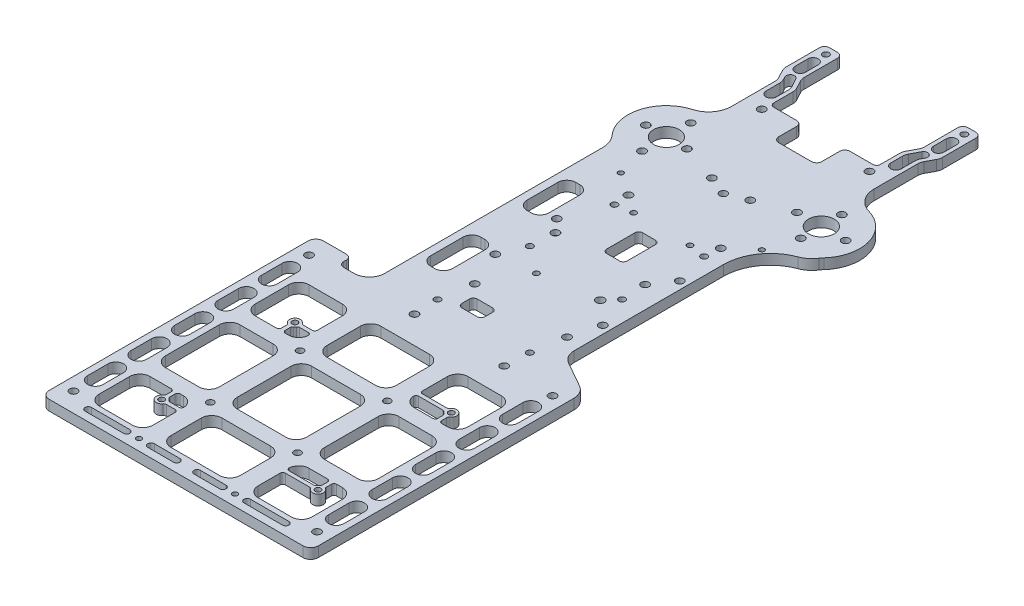
from build123d import *
from OCP.BRepFilletAPI import BRepFilletAPI_MakeChamfer

# Parameters (mm, degrees)
SKETCH_1_W                = 130
SKETCH_1_H                = 250
SKETCH_1_R                = 5
SKETCH_1_R_2              = 1.5
SKETCH_1_R_3              = 1.45
EXTRUDE_1_DEPTH           = 4
SKETCH_2_R                = 1.5
SKETCH_2_R_2              = 1.25
SKETCH_2_R_3              = 1.1
SKETCH_2_R_4              = 1.6
CUT_EXTRUDE_1_DEPTH       = 162.694155739
SKETCH_3_R                = 1.25
EXTRUDE_2_DEPTH           = 4
SKETCH_8_R                = 1
CUT_EXTRUDE_5_DEPTH       = 162.694155739
CUT_EXTRUDE_7_DEPTH       = 162.694155739
FILLET_1_R                = 2
FILLET_10_R               = 4
FILLET_2_R                = 6
FILLET_3_R                = 2
SKETCH_5_R                = 1.5
SKETCH_5_R_2              = 1.25
SKETCH_5_W                = 9
SKETCH_5_H                = 6
SKETCH_5_W_2              = 8
SKETCH_5_H_2              = 14
CUT_EXTRUDE_2_DEPTH       = 162.694155739
FILLET_4_R                = 1.5
CUT_EXTRUDE_START         = -4
CUT_EXTRUDE_3_OUTLINE_W   = 27
CUT_EXTRUDE_3_OUTLINE_H   = 29
CUT_EXTRUDE_3_OUTLINE_H_2 = 21
CUT_EXTRUDE_3_OUTLINE_H_3 = 19.88
CUT_EXTRUDE_3_OUTLINE_W_2 = 21
CUT_EXTRUDE_3_OUTLINE_R   = 1.35
CUT_EXTRUDE_3_DEPTH       = 4
FILLET_5_R                = 4
SKETCH_7_R                = 1
CUT_EXTRUDE_4_DEPTH       = 162.694155739
FILLET_6_R                = 3
FILLET_7_R                = 6
FILLET_8_R                = 2
SKETCH_9_W                = 8.582794104
SKETCH_9_H                = 19.62
SKETCH_9_H_2              = 19
CUT_EXTRUDE_6_DEPTH       = 162.694155739
FILLET_9_R                = 3.5
EXTRUDE_3_DEPTH           = 4
FILLET_11_R               = 1
CHAMFER_1_SIZE            = 2
CHAMFER_1_SIZE2           = 1.5


# Read off the part's stored shape, not the designer's step: 切除-拉伸3
with BuildPart() as part:
    # 草图1 → 凸台-拉伸1 (new body)
    with BuildSketch(Plane(origin=(0, 0, 0), x_dir=(1, 0, 0), z_dir=(0, 1, 0))):
        with Locations((0, -23)):
            Rectangle(SKETCH_1_W, SKETCH_1_H)
        with Locations(Location((-30.225, 61, 0), (0, 0, 270))):
            Circle(SKETCH_1_R, mode=Mode.SUBTRACT)
        with Locations(Location((-38.225, 61, 0), (0, 0, 270))):
            Circle(SKETCH_1_R_2, mode=Mode.SUBTRACT)
        with Locations(Location((-22.225, 61, 0), (0, 0, 270))):
            Circle(SKETCH_1_R_2, mode=Mode.SUBTRACT)
        with Locations(Location((-30.225, 70.5, 0), (0, 0, 270))):
            Circle(SKETCH_1_R_2, mode=Mode.SUBTRACT)
        with Locations(Location((-30.225, 51.5, 0), (0, 0, 270))):
            Circle(SKETCH_1_R_2, mode=Mode.SUBTRACT)
        with Locations(Location((30.225, 61, 0), (0, 0, 270))):
            Circle(SKETCH_1_R, mode=Mode.SUBTRACT)
        with Locations(Location((30.225, 53, 0), (0, 0, 270))):
            Circle(SKETCH_1_R_2, mode=Mode.SUBTRACT)
        with Locations(Location((30.225, 69, 0), (0, 0, 270))):
            Circle(SKETCH_1_R_2, mode=Mode.SUBTRACT)
        with Locations(Location((20.725, 61, 0), (0, 0, 270))):
            Circle(SKETCH_1_R_2, mode=Mode.SUBTRACT)
        with Locations(Location((39.725, 61, 0), (0, 0, 270))):
            Circle(SKETCH_1_R_2, mode=Mode.SUBTRACT)
        with Locations(Location((-21, 89, 0), (0, 0, 270))):
            Circle(SKETCH_1_R_2, mode=Mode.SUBTRACT)
        with Locations(Location((21, 89, 0), (0, 0, 90))):
            Circle(SKETCH_1_R_2, mode=Mode.SUBTRACT)
        with Locations(Location((-60, -48.62, 0), (0, 0, 270))):
            Circle(SKETCH_1_R_2, mode=Mode.SUBTRACT)
        with Locations(Location((-60, -140.5, 0), (0, 0, 270))):
            Circle(SKETCH_1_R_2, mode=Mode.SUBTRACT)
        with Locations(Location((35, -140.5, 0), (0, 0, 90))):
            Circle(SKETCH_1_R_2, mode=Mode.SUBTRACT)
        with Locations(Location((35, -48.62, 0), (0, 0, 90))):
            Circle(SKETCH_1_R_2, mode=Mode.SUBTRACT)
        with Locations(Location((-7.5, 56, 0), (0, 0, 270))):
            Circle(SKETCH_1_R_2, mode=Mode.SUBTRACT)
        with Locations(Location((7.5, 56, 0), (0, 0, 90))):
            Circle(SKETCH_1_R_2, mode=Mode.SUBTRACT)
        with Locations(Location((0, 53, 0), (0, 0, 270))):
            Circle(SKETCH_1_R_3, mode=Mode.SUBTRACT)
    extrude(amount=EXTRUDE_1_DEPTH)

    # 草图2 → 切除-拉伸1 (cut, through all)
    with BuildSketch(Plane(origin=(0, 4, 0), x_dir=(1, 0, 0), z_dir=(0, 1, 0))):
        Polygon((20.8, 102), (-20.8, 102), (-20.8, 92), (-8.4, 92), (-8.4, 81), (8.4, 81), (8.4, 92), (20.8, 92), align=None)
        with BuildLine():
            Line((-27.85, 84), (-27.85, 102))
            Line((-27.85, 102), (-65, 102))
            Line((-65, 102), (-65, -41))
            Line((-65, -41), (-51.082794104, -41))
            Line((-51.082794104, -41), (-51.082794104, -46))
            Line((-51.082794104, -46), (-39.082794104, -46))
            Line((-39.082794104, -46), (-39.082794104, 45))
            ThreePointArc((-39.082794104, 45), (-39.674693481, 48.193418147), (-41.371755389, 50.962577806))
            ThreePointArc((-41.371755389, 50.962577806), (-44.639046128, 65.151538779), (-34.324986836, 75.428794404))
            ThreePointArc((-34.324986836, 75.428794404), (-29.650694588, 78.62898939), (-27.85, 84))
        make_face()
        with BuildLine():
            ThreePointArc((41.371755389, 50.962577806), (40.920524993, 50.419688798), (40.513686931, 49.842783141))
            ThreePointArc((40.513686931, 49.842783141), (38.507267418, 47.62069527), (35.904154342, 46.141778068))
            ThreePointArc((35.904154342, 46.141778068), (27.267917933, 39.434910708), (24, 29))
            Line((24, 29), (24, -32.681874819))
            Line((24, -32.681874819), (40, -41.78))
            Line((40, -41.78), (40, -148))
            Line((40, -148), (65, -148))
            Line((65, -148), (65, 102))
            Line((65, 102), (27.85, 102))
            Line((27.85, 102), (27.85, 84))
            ThreePointArc((27.85, 84), (29.650694588, 78.62898939), (34.324986836, 75.428794404))
            ThreePointArc((34.324986836, 75.428794404), (44.639046128, 65.151538779), (41.371755389, 50.962577806))
        make_face()
        with Locations(Location((21, 15, 0), (0, 0, 270))):
            Circle(SKETCH_2_R)
        with Locations(Location((21, -15, 0), (0, 0, 90))):
            Circle(SKETCH_2_R)
        with Locations(Location((-18, 34, 0), (0, 0, 270))):
            Circle(SKETCH_2_R)
        with Locations(Location((18, 34, 0), (0, 0, 270))):
            Circle(SKETCH_2_R)
        with Locations(Location((-18, -26, 0), (0, 0, 270))):
            Circle(SKETCH_2_R)
        with Locations(Location((18, -26, 0), (0, 0, 270))):
            Circle(SKETCH_2_R)
        with Locations(Location((-24, -12, 0), (0, 0, 270))):
            Circle(SKETCH_2_R)
        with Locations(Location((-24, 12, 0), (0, 0, 270))):
            Circle(SKETCH_2_R)
        with Locations(Location((-17.5, 28, 0), (0, 0, 270))):
            Circle(SKETCH_2_R_2)
        with Locations(Location((17.5, 28, 0), (0, 0, 270))):
            Circle(SKETCH_2_R_2)
        with Locations(Location((-9.527699014, -10.417590797, 0), (0, 0, 270))):
            Circle(SKETCH_2_R_3)
        with Locations(Location((11, 29.000000002, 0), (0, 0, 270))):
            Circle(SKETCH_2_R_3)
        with Locations(Location((-11, 29.000000002, 0), (0, 0, 270))):
            Circle(SKETCH_2_R_3)
        with Locations(Location((12, -7, 0), (0, 0, 270))):
            Circle(SKETCH_2_R_4)
    extrude(amount=-CUT_EXTRUDE_1_DEPTH, mode=Mode.SUBTRACT)

    # 草图3 → 凸台-拉伸2 (add)
    # profile 1 of 2: a face of its own
    with BuildSketch(Plane(origin=(0, 4, 0), x_dir=(1, 0, 0), z_dir=(0, 1, 0))):
        Polygon((-30.525, 123), (-23.475, 123), (-23.475, 107), (-20.8, 102), (-27.85, 102), (-30.525, 107), align=None)
        with Locations(Location((-27, 120, 0), (0, 0, 270))):
            Circle(SKETCH_3_R, mode=Mode.SUBTRACT)
        with BuildLine():
            Line((-24.975, 115), (-24.975, 110))
            ThreePointArc((-24.975, 110), (-27, 107.975), (-29.025, 110))
            Line((-29.025, 110), (-29.025, 115))
            ThreePointArc((-29.025, 115), (-27, 117.025), (-24.975, 115))
        make_face(mode=Mode.SUBTRACT)
    # profile 2 of 2: a face of its own
    with BuildSketch(Plane(origin=(0, 4, 0), x_dir=(1, 0, 0), z_dir=(0, 1, 0))):
        Polygon((20.8, 102), (23.475, 107), (23.475, 123), (30.525, 123), (30.525, 107), (27.85, 102), align=None)
        with Locations(Location((27, 120, 0), (0, 0, 270))):
            Circle(SKETCH_3_R, mode=Mode.SUBTRACT)
        with BuildLine():
            Line((24.975, 115), (24.975, 110))
            ThreePointArc((24.975, 110), (27, 107.975), (29.025, 110))
            Line((29.025, 110), (29.025, 115))
            ThreePointArc((29.025, 115), (27, 117.025), (24.975, 115))
        make_face(mode=Mode.SUBTRACT)
    extrude(amount=-EXTRUDE_2_DEPTH)

    # 草图8 → 切除-拉伸5 (cut, through all)
    with BuildSketch(Plane(origin=(0, 4, 0), x_dir=(1, 0, 0), z_dir=(0, 1, 0))):
        with Locations(Location((-27, 40, 0), (0, 0, 270))):
            Circle(SKETCH_8_R)
        with Locations(Location((26.5, 41.5, 0), (0, 0, 270))):
            Circle(SKETCH_8_R)
    extrude(amount=-CUT_EXTRUDE_5_DEPTH, mode=Mode.SUBTRACT)

    # 草图10 → 切除-拉伸7 (cut, through all)
    with BuildSketch(Plane(origin=(0, 4, 0), x_dir=(1, 0, 0), z_dir=(0, 1, 0))):
        with BuildLine():
            Line((-27.403592373, 104.345364997), (-26.35, 102.376033459))
            Line((-26.35, 102.376033459), (-26.35, 96))
            ThreePointArc((-26.35, 96), (-24.325, 93.975), (-22.3, 96))
            Line((-22.3, 96), (-22.3, 101.623966541))
            Line((-22.3, 101.623966541), (-24.567662269, 105.862587603))
            ThreePointArc((-24.567662269, 105.862587603), (-26.744238624, 106.521941353), (-27.403592373, 104.345364997))
        make_face()
        with BuildLine():
            Line((22.3, 101.623966541), (24.567662269, 105.862587603))
            ThreePointArc((24.567662269, 105.862587603), (26.744238624, 106.521941353), (27.403592373, 104.345364997))
            Line((27.403592373, 104.345364997), (26.35, 102.376033459))
            Line((26.35, 102.376033459), (26.35, 96))
            ThreePointArc((26.35, 96), (24.325, 93.975), (22.3, 96))
            Line((22.3, 96), (22.3, 101.623966541))
        make_face()
    extrude(amount=-CUT_EXTRUDE_7_DEPTH, mode=Mode.SUBTRACT)

    # 圆角1
    fillet_1_edges = [part.edges().sort_by_distance(p)[0] for p in [
        (23.475, 2, -123),
        (30.525, 2, -123),
        (-23.475, 2, -123),
        (-30.525, 2, -123),
    ]]
    fillet(fillet_1_edges, radius=FILLET_1_R)

    # 圆角10
    fillet_10_edges = [part.edges().sort_by_distance(p)[0] for p in [
        (27.85, 2, -102),
        (-27.85, 2, -102),
        (-20.8, 2, -102),
        (20.8, 2, -102),
        (23.475, 2, -107),
        (30.525, 2, -107),
        (-23.475, 2, -107),
        (-30.525, 2, -107),
        (-22.3, 2, -101.623966541),
        (-26.35, 2, -102.376033459),
        (22.3, 2, -101.623966541),
        (26.35, 2, -102.376033459),
    ]]
    fillet(fillet_10_edges, radius=FILLET_10_R)

    # 圆角2
    fillet_2_edges = [part.edges().sort_by_distance(p)[0] for p in [
        (-39.082794104, 2, 46),
    ]]
    fillet(fillet_2_edges, radius=FILLET_2_R)

    # 圆角3
    fillet_3_edges = [part.edges().sort_by_distance(p)[0] for p in [
        (-51.082794104, 2, 46),
        (-51.082794104, 2, 41),
    ]]
    fillet(fillet_3_edges, radius=FILLET_3_R)

    # 草图5 → 切除-拉伸2 (cut, through all)
    with BuildSketch(Plane(origin=(0, 4, 0), x_dir=(1, 0, 0), z_dir=(0, 1, 0))):
        with Locations(Location((-19.5, 7, 0), (0, 0, 270))):
            Circle(SKETCH_5_R)
        with Locations(Location((-19.5, -48, 0), (0, 0, 270))):
            Circle(SKETCH_5_R)
        with Locations(Location((-20, -2.5, 0), (0, 0, 270))):
            Circle(SKETCH_5_R_2)
        with Locations(Location((16, -2.5, 0), (0, 0, 270))):
            Circle(SKETCH_5_R_2)
        with Locations(Location((16, -38.5, 0), (0, 0, 270))):
            Circle(SKETCH_5_R_2)
        with Locations(Location((-20, -38.5, 0), (0, 0, 270))):
            Circle(SKETCH_5_R_2)
        with Locations(Location((15.5, -48, 0), (0, 0, 90))):
            Circle(SKETCH_5_R)
        with Locations(Location((15.5, 7, 0), (0, 0, 90))):
            Circle(SKETCH_5_R)
        with Locations((-9.4, -33.62)):
            Rectangle(SKETCH_5_W, SKETCH_5_H)
        with Locations((0, 17)):
            Rectangle(SKETCH_5_W_2, SKETCH_5_H_2)
    extrude(amount=-CUT_EXTRUDE_2_DEPTH, mode=Mode.SUBTRACT)

    # 圆角4
    fillet_4_edges = [part.edges().sort_by_distance(p)[0] for p in [
        (20.8, 2, -92),
        (-20.8, 2, -92),
        (-4.9, 2, 30.62),
        (-4.9, 2, 36.62),
        (-13.9, 2, 36.62),
        (-13.9, 2, 30.62),
        (4, 2, -24),
        (4, 2, -10),
        (-4, 2, -10),
        (-4, 2, -24),
    ]]
    fillet(fillet_4_edges, radius=FILLET_4_R)

    # 切除-拉伸3 outline → 切除-拉伸3 (cut)
    with BuildSketch(Plane(origin=(0, 4, 0), x_dir=(1, 0, 0), z_dir=(0, 1, 0)).offset(CUT_EXTRUDE_START)):
        with Locations((-12.5, -100.12)):
            Rectangle(CUT_EXTRUDE_3_OUTLINE_W, CUT_EXTRUDE_3_OUTLINE_H)
        with Locations((-12.5, -69.12)):
            Rectangle(CUT_EXTRUDE_3_OUTLINE_W, CUT_EXTRUDE_3_OUTLINE_H_2)
        with Locations((-12.5, -130.56)):
            Rectangle(CUT_EXTRUDE_3_OUTLINE_W, CUT_EXTRUDE_3_OUTLINE_H_3)
        with Locations((-43.5, -100.12)):
            Rectangle(CUT_EXTRUDE_3_OUTLINE_W_2, CUT_EXTRUDE_3_OUTLINE_H)
        with Locations((18.5, -100.12)):
            Rectangle(CUT_EXTRUDE_3_OUTLINE_W_2, CUT_EXTRUDE_3_OUTLINE_H)
        with Locations((18.5, -130.56)):
            Rectangle(CUT_EXTRUDE_3_OUTLINE_W_2, CUT_EXTRUDE_3_OUTLINE_H_3)
        with Locations((18.5, -69.12)):
            Rectangle(CUT_EXTRUDE_3_OUTLINE_W_2, CUT_EXTRUDE_3_OUTLINE_H_2)
        with Locations((-43.5, -130.56)):
            Rectangle(CUT_EXTRUDE_3_OUTLINE_W_2, CUT_EXTRUDE_3_OUTLINE_H_3)
        with Locations((-43.5, -69.12)):
            Rectangle(CUT_EXTRUDE_3_OUTLINE_W_2, CUT_EXTRUDE_3_OUTLINE_H_2)
        with Locations((-29.5, -117.62)):
            Circle(CUT_EXTRUDE_3_OUTLINE_R)
        with Locations((4.5, -82.62)):
            Circle(CUT_EXTRUDE_3_OUTLINE_R)
        with Locations((-29.5, -82.62)):
            Circle(CUT_EXTRUDE_3_OUTLINE_R)
        with Locations((4.5, -117.62)):
            Circle(CUT_EXTRUDE_3_OUTLINE_R)
    extrude(amount=CUT_EXTRUDE_3_DEPTH, mode=Mode.SUBTRACT)

    # 圆角5
    fillet_5_edges = [part.edges().sort_by_distance(p)[0] for p in [
        (8, 2, 114.62),
        (8, 2, 85.62),
        (29, 2, 85.62),
        (29, 2, 114.62),
        (8, 2, 79.62),
        (8, 2, 58.62),
        (29, 2, 58.62),
        (29, 2, 79.62),
        (-26, 2, 140.5),
        (-26, 2, 120.62),
        (1, 2, 120.62),
        (1, 2, 140.5),
        (-26, 2, 79.62),
        (-26, 2, 58.62),
        (1, 2, 58.62),
        (1, 2, 79.62),
        (-54, 2, 114.62),
        (-54, 2, 85.62),
        (-33, 2, 85.62),
        (-33, 2, 114.62),
        (-54, 2, 79.62),
        (-54, 2, 58.62),
        (-33, 2, 58.62),
        (-33, 2, 79.62),
        (-54, 2, 120.62),
        (-33, 2, 120.62),
        (-33, 2, 140.5),
        (-54, 2, 140.5),
        (8, 2, 140.5),
        (8, 2, 120.62),
        (29, 2, 120.62),
        (29, 2, 140.5),
        (-26, 2, 114.62),
        (-26, 2, 85.62),
        (1, 2, 85.62),
        (1, 2, 114.62),
    ]]
    fillet(fillet_5_edges, radius=FILLET_5_R)

    # 草图7 → 切除-拉伸4 (cut, through all)
    with BuildSketch(Plane(origin=(0, 4, 0), x_dir=(1, 0, 0), z_dir=(0, 1, 0))):
        with Locations(Location((-31.25, -143.75, 0), (0, 0, 270))):
            Circle(SKETCH_7_R)
        with Locations(Location((6.25, -143.75, 0), (0, 0, 90))):
            Circle(SKETCH_7_R)
        with BuildLine():
            Line((-56.5, -56.62), (-56.5, -64.62))
            ThreePointArc((-56.5, -64.62), (-59.5, -67.62), (-62.5, -64.62))
            Line((-62.5, -64.62), (-62.5, -56.62))
            ThreePointArc((-62.5, -56.62), (-59.5, -53.62), (-56.5, -56.62))
        make_face()
        with BuildLine():
            Line((31.5, -56.62), (31.5, -64.62))
            ThreePointArc((31.5, -64.62), (34.5, -67.62), (37.5, -64.62))
            Line((37.5, -64.62), (37.5, -56.62))
            ThreePointArc((37.5, -56.62), (34.5, -53.62), (31.5, -56.62))
        make_face()
        with BuildLine():
            Line((-56.5, -73.59), (-56.5, -81.59))
            ThreePointArc((-56.5, -81.59), (-59.5, -84.59), (-62.5, -81.59))
            Line((-62.5, -81.59), (-62.5, -73.59))
            ThreePointArc((-62.5, -73.59), (-59.5, -70.59), (-56.5, -73.59))
        make_face()
        with BuildLine():
            Line((31.5, -73.59), (31.5, -81.59))
            ThreePointArc((31.5, -81.59), (34.5, -84.59), (37.5, -81.59))
            Line((37.5, -81.59), (37.5, -73.59))
            ThreePointArc((37.5, -73.59), (34.5, -70.59), (31.5, -73.59))
        make_face()
        with BuildLine():
            Line((-56.5, -90.56), (-56.5, -98.56))
            ThreePointArc((-56.5, -98.56), (-59.5, -101.56), (-62.5, -98.56))
            Line((-62.5, -98.56), (-62.5, -90.56))
            ThreePointArc((-62.5, -90.56), (-59.5, -87.56), (-56.5, -90.56))
        make_face()
        with BuildLine():
            Line((31.5, -90.56), (31.5, -98.56))
            ThreePointArc((31.5, -98.56), (34.5, -101.56), (37.5, -98.56))
            Line((37.5, -98.56), (37.5, -90.56))
            ThreePointArc((37.5, -90.56), (34.5, -87.56), (31.5, -90.56))
        make_face()
        with BuildLine():
            Line((-56.5, -107.53), (-56.5, -115.53))
            ThreePointArc((-56.5, -115.53), (-59.5, -118.53), (-62.5, -115.53))
            Line((-62.5, -115.53), (-62.5, -107.53))
            ThreePointArc((-62.5, -107.53), (-59.5, -104.53), (-56.5, -107.53))
        make_face()
        with BuildLine():
            Line((31.5, -107.53), (31.5, -115.53))
            ThreePointArc((31.5, -115.53), (34.5, -118.53), (37.5, -115.53))
            Line((37.5, -115.53), (37.5, -107.53))
            ThreePointArc((37.5, -107.53), (34.5, -104.53), (31.5, -107.53))
        make_face()
        with BuildLine():
            Line((-56.5, -124.5), (-56.5, -132.5))
            ThreePointArc((-56.5, -132.5), (-59.5, -135.5), (-62.5, -132.5))
            Line((-62.5, -132.5), (-62.5, -124.5))
            ThreePointArc((-62.5, -124.5), (-59.5, -121.5), (-56.5, -124.5))
        make_face()
        with BuildLine():
            Line((31.5, -124.5), (31.5, -132.5))
            ThreePointArc((31.5, -132.5), (34.5, -135.5), (37.5, -132.5))
            Line((37.5, -132.5), (37.5, -124.5))
            ThreePointArc((37.5, -124.5), (34.5, -121.5), (31.5, -124.5))
        make_face()
        with BuildLine():
            Line((-8.5, -142.5), (1.5, -142.5))
            ThreePointArc((1.5, -142.5), (2.75, -143.75), (1.5, -145))
            Line((1.5, -145), (-8.5, -145))
            ThreePointArc((-8.5, -145), (-9.75, -143.75), (-8.5, -142.5))
        make_face()
        with BuildLine():
            Line((11, -142.5), (26, -142.5))
            ThreePointArc((26, -142.5), (27.25, -143.75), (26, -145))
            Line((26, -145), (11, -145))
            ThreePointArc((11, -145), (9.75, -143.75), (11, -142.5))
        make_face()
        with BuildLine():
            Line((-16.5, -142.5), (-26.5, -142.5))
            ThreePointArc((-26.5, -142.5), (-27.75, -143.75), (-26.5, -145))
            Line((-26.5, -145), (-16.5, -145))
            ThreePointArc((-16.5, -145), (-15.25, -143.75), (-16.5, -142.5))
        make_face()
        with BuildLine():
            Line((-36, -142.5), (-51, -142.5))
            ThreePointArc((-51, -142.5), (-52.25, -143.75), (-51, -145))
            Line((-51, -145), (-36, -145))
            ThreePointArc((-36, -145), (-34.75, -143.75), (-36, -142.5))
        make_face()
    extrude(amount=-CUT_EXTRUDE_4_DEPTH, mode=Mode.SUBTRACT)

    # 圆角6
    fillet_6_edges = [part.edges().sort_by_distance(p)[0] for p in [
        (40, 2, 148),
        (-65, 2, 41),
        (-65, 2, 148),
    ]]
    fillet(fillet_6_edges, radius=FILLET_6_R)

    # 圆角7
    fillet_7_edges = [part.edges().sort_by_distance(p)[0] for p in [
        (40, 2, 41.78),
        (24, 2, 32.681874819),
    ]]
    fillet(fillet_7_edges, radius=FILLET_7_R)

    # 圆角8
    fillet_8_edges = [part.edges().sort_by_distance(p)[0] for p in [
        (-8.4, 2, -92),
        (-8.4, 2, -81),
        (8.4, 2, -81),
        (8.4, 2, -92),
    ]]
    fillet(fillet_8_edges, radius=FILLET_8_R)

    # 草图9 → 切除-拉伸6 (cut, through all)
    with BuildSketch(Plane(origin=(0, 4, 0), x_dir=(1, 0, 0), z_dir=(0, 1, 0))):
        with Locations((-31.791397052, -18.81)):
            Rectangle(SKETCH_9_W, SKETCH_9_H)
        with Locations((-31.791397052, 18.5)):
            Rectangle(SKETCH_9_W, SKETCH_9_H_2)
    extrude(amount=-CUT_EXTRUDE_6_DEPTH, mode=Mode.SUBTRACT)

    # 圆角9
    fillet_9_edges = [part.edges().sort_by_distance(p)[0] for p in [
        (-27.5, 2, 9),
        (-27.5, 2, 28.62),
        (-36.082794104, 2, 28.62),
        (-36.082794104, 2, 9),
        (-27.5, 2, -28),
        (-27.5, 2, -9),
        (-36.082794104, 2, -9),
        (-36.082794104, 2, -28),
    ]]
    fillet(fillet_9_edges, radius=FILLET_9_R)

    # 草图11 → 凸台-拉伸3 (add)
    with BuildSketch(Plane(origin=(0, 4, 0), x_dir=(1, 0, 0), z_dir=(0, 1, 0))):
        with BuildLine():
            Line((-33, -73.37), (-38.038495475, -73.37))
            ThreePointArc((-38.038495475, -73.37), (-37.934914106, -73.73865993), (-37.9, -74.12))
            ThreePointArc((-37.9, -74.12), (-37.934914106, -74.50134007), (-38.038495475, -74.87))
            Line((-38.038495475, -74.87), (-33, -74.87))
            Line((-33, -74.87), (-33, -73.37))
        make_face()
        with BuildLine():
            Line((-40.75, -76.081504525), (-40.75, -74.924673847))
            ThreePointArc((-40.75, -74.924673847), (-40.777817459, -73.342182541), (-39.195326153, -73.37))
            Line((-39.195326153, -73.37), (-38.038495475, -73.37))
            ThreePointArc((-38.038495475, -73.37), (-41.48492424, -72.63507576), (-40.75, -76.081504525))
        make_face()
        with BuildLine():
            ThreePointArc((-39.25, -74.924673847), (-40, -75.22), (-40.75, -74.924673847))
            Line((-40.75, -74.924673847), (-40.75, -76.081504525))
            ThreePointArc((-40.75, -76.081504525), (-40, -76.22), (-39.25, -76.081504525))
            Line((-39.25, -76.081504525), (-39.25, -74.924673847))
        make_face()
        with BuildLine():
            ThreePointArc((-39.195326153, -74.87), (-39.222182541, -74.897817459), (-39.25, -74.924673847))
            Line((-39.25, -74.924673847), (-39.25, -76.081504525))
            ThreePointArc((-39.25, -76.081504525), (-38.51507576, -75.60492424), (-38.038495475, -74.87))
            Line((-38.038495475, -74.87), (-39.195326153, -74.87))
        make_face()
        with BuildLine():
            Line((-38.038495475, -73.37), (-39.195326153, -73.37))
            ThreePointArc((-39.195326153, -73.37), (-38.976491028, -73.71697471), (-38.9, -74.12))
            ThreePointArc((-38.9, -74.12), (-38.976491028, -74.52302529), (-39.195326153, -74.87))
            Line((-39.195326153, -74.87), (-38.038495475, -74.87))
            ThreePointArc((-38.038495475, -74.87), (-37.934914106, -74.50134007), (-37.9, -74.12))
            ThreePointArc((-37.9, -74.12), (-37.934914106, -73.73865993), (-38.038495475, -73.37))
        make_face()
        with BuildLine():
            ThreePointArc((-39.25, -76.081504525), (-40, -76.22), (-40.75, -76.081504525))
            Line((-40.75, -76.081504525), (-40.75, -79.62))
            Line((-40.75, -79.62), (-39.25, -79.62))
            Line((-39.25, -79.62), (-39.25, -76.081504525))
        make_face()
        with BuildLine():
            Line((19.038495475, -73.37), (8, -73.37))
            Line((8, -73.37), (8, -74.87))
            Line((8, -74.87), (19.038495475, -74.87))
            ThreePointArc((19.038495475, -74.87), (18.9, -74.12), (19.038495475, -73.37))
        make_face()
        with BuildLine():
            Line((20.195326153, -73.37), (19.038495475, -73.37))
            ThreePointArc((19.038495475, -73.37), (18.9, -74.12), (19.038495475, -74.87))
            Line((19.038495475, -74.87), (20.195326153, -74.87))
            ThreePointArc((20.195326153, -74.87), (19.9, -74.12), (20.195326153, -73.37))
        make_face()
        with BuildLine():
            Line((20.195326153, -74.87), (19.038495475, -74.87))
            ThreePointArc((19.038495475, -74.87), (19.51507576, -75.60492424), (20.25, -76.081504525))
            Line((20.25, -76.081504525), (20.25, -74.924673847))
            ThreePointArc((20.25, -74.924673847), (20.222182541, -74.897817459), (20.195326153, -74.87))
        make_face()
        with BuildLine():
            ThreePointArc((20.25, -76.081504525), (21, -76.22), (21.75, -76.081504525))
            Line((21.75, -76.081504525), (21.75, -74.924673847))
            ThreePointArc((21.75, -74.924673847), (21, -75.22), (20.25, -74.924673847))
            Line((20.25, -74.924673847), (20.25, -76.081504525))
        make_face()
        with BuildLine():
            ThreePointArc((23.1, -74.12), (21.38134007, -72.054914106), (19.038495475, -73.37))
            Line((19.038495475, -73.37), (20.195326153, -73.37))
            ThreePointArc((20.195326153, -73.37), (21.40302529, -73.096491028), (22.1, -74.12))
            ThreePointArc((22.1, -74.12), (22.00871205, -74.558748219), (21.75, -74.924673847))
            Line((21.75, -74.924673847), (21.75, -76.081504525))
            ThreePointArc((21.75, -76.081504525), (22.729884389, -75.31058809), (23.1, -74.12))
        make_face()
        with BuildLine():
            Line((21.75, -79.62), (21.75, -76.081504525))
            ThreePointArc((21.75, -76.081504525), (21, -76.22), (20.25, -76.081504525))
            Line((20.25, -76.081504525), (20.25, -79.62))
            Line((20.25, -79.62), (21.75, -79.62))
        make_face()
        with BuildLine():
            Line((20.195326153, -126.87), (19.038495475, -126.87))
            ThreePointArc((19.038495475, -126.87), (21.38134007, -128.185085894), (23.1, -126.12))
            ThreePointArc((23.1, -126.12), (22.729884389, -124.92941191), (21.75, -124.158495475))
            Line((21.75, -124.158495475), (21.75, -125.315326153))
            ThreePointArc((21.75, -125.315326153), (22.00871205, -125.681251781), (22.1, -126.12))
            ThreePointArc((22.1, -126.12), (21.40302529, -127.143508972), (20.195326153, -126.87))
        make_face()
        with BuildLine():
            Line((21.75, -125.315326153), (21.75, -124.158495475))
            ThreePointArc((21.75, -124.158495475), (21, -124.02), (20.25, -124.158495475))
            Line((20.25, -124.158495475), (20.25, -125.315326153))
            ThreePointArc((20.25, -125.315326153), (21, -125.02), (21.75, -125.315326153))
        make_face()
        with BuildLine():
            ThreePointArc((20.25, -124.158495475), (19.51507576, -124.63507576), (19.038495475, -125.37))
            Line((19.038495475, -125.37), (20.195326153, -125.37))
            ThreePointArc((20.195326153, -125.37), (20.222182541, -125.342182541), (20.25, -125.315326153))
            Line((20.25, -125.315326153), (20.25, -124.158495475))
        make_face()
        with BuildLine():
            ThreePointArc((19.038495475, -125.37), (18.9, -126.12), (19.038495475, -126.87))
            Line((19.038495475, -126.87), (20.195326153, -126.87))
            ThreePointArc((20.195326153, -126.87), (19.9, -126.12), (20.195326153, -125.37))
            Line((20.195326153, -125.37), (19.038495475, -125.37))
        make_face()
        with BuildLine():
            Line((8, -125.37), (8, -126.87))
            Line((8, -126.87), (19.038495475, -126.87))
            ThreePointArc((19.038495475, -126.87), (18.9, -126.12), (19.038495475, -125.37))
            Line((19.038495475, -125.37), (8, -125.37))
        make_face()
        with BuildLine():
            Line((21.75, -124.158495475), (21.75, -120.62))
            Line((21.75, -120.62), (20.25, -120.62))
            Line((20.25, -120.62), (20.25, -124.158495475))
            ThreePointArc((20.25, -124.158495475), (21, -124.02), (21.75, -124.158495475))
        make_face()
        with BuildLine():
            Line((-40.75, -125.315326153), (-40.75, -124.158495475))
            ThreePointArc((-40.75, -124.158495475), (-41.48492424, -127.60492424), (-38.038495475, -126.87))
            Line((-38.038495475, -126.87), (-39.195326153, -126.87))
            ThreePointArc((-39.195326153, -126.87), (-40.777817459, -126.897817459), (-40.75, -125.315326153))
        make_face()
        with BuildLine():
            Line((-39.195326153, -126.87), (-38.038495475, -126.87))
            ThreePointArc((-38.038495475, -126.87), (-37.934914106, -126.50134007), (-37.9, -126.12))
            ThreePointArc((-37.9, -126.12), (-37.934914106, -125.73865993), (-38.038495475, -125.37))
            Line((-38.038495475, -125.37), (-39.195326153, -125.37))
            ThreePointArc((-39.195326153, -125.37), (-38.976491028, -125.71697471), (-38.9, -126.12))
            ThreePointArc((-38.9, -126.12), (-38.976491028, -126.52302529), (-39.195326153, -126.87))
        make_face()
        with BuildLine():
            ThreePointArc((-38.038495475, -125.37), (-38.51507576, -124.63507576), (-39.25, -124.158495475))
            Line((-39.25, -124.158495475), (-39.25, -125.315326153))
            ThreePointArc((-39.25, -125.315326153), (-39.222182541, -125.342182541), (-39.195326153, -125.37))
            Line((-39.195326153, -125.37), (-38.038495475, -125.37))
        make_face()
        with BuildLine():
            ThreePointArc((-39.25, -124.158495475), (-40, -124.02), (-40.75, -124.158495475))
            Line((-40.75, -124.158495475), (-40.75, -125.315326153))
            ThreePointArc((-40.75, -125.315326153), (-40, -125.02), (-39.25, -125.315326153))
            Line((-39.25, -125.315326153), (-39.25, -124.158495475))
        make_face()
        with BuildLine():
            ThreePointArc((-37.9, -126.12), (-37.934914106, -126.50134007), (-38.038495475, -126.87))
            Line((-38.038495475, -126.87), (-33, -126.87))
            Line((-33, -126.87), (-33, -125.37))
            Line((-33, -125.37), (-38.038495475, -125.37))
            ThreePointArc((-38.038495475, -125.37), (-37.934914106, -125.73865993), (-37.9, -126.12))
        make_face()
        with BuildLine():
            Line((-39.25, -120.62), (-40.75, -120.62))
            Line((-40.75, -120.62), (-40.75, -124.158495475))
            ThreePointArc((-40.75, -124.158495475), (-40, -124.02), (-39.25, -124.158495475))
            Line((-39.25, -124.158495475), (-39.25, -120.62))
        make_face()
    extrude(amount=-EXTRUDE_3_DEPTH)

    # 圆角11
    fillet_11_edges = [part.edges().sort_by_distance(p)[0] for p in [
        (-40.75, 2, 79.62),
        (-39.25, 2, 79.62),
        (-39.25, 2, 76.081504525),
        (-38.038495475, 2, 74.87),
        (-33, 2, 74.87),
        (-33, 2, 73.37),
        (-38.038495475, 2, 73.37),
        (-40.75, 2, 76.081504525),
        (20.25, 2, 79.62),
        (21.75, 2, 79.62),
        (21.75, 2, 76.081504525),
        (19.038495475, 2, 73.37),
        (8, 2, 73.37),
        (8, 2, 74.87),
        (19.038495475, 2, 74.87),
        (20.25, 2, 76.081504525),
        (8, 2, 125.37),
        (8, 2, 126.87),
        (19.038495475, 2, 126.87),
        (21.75, 2, 124.158495475),
        (21.75, 2, 120.62),
        (20.25, 2, 120.62),
        (20.25, 2, 124.158495475),
        (19.038495475, 2, 125.37),
        (-39.25, 2, 120.62),
        (-40.75, 2, 120.62),
        (-40.75, 2, 124.158495475),
        (-38.038495475, 2, 126.87),
        (-33, 2, 126.87),
        (-33, 2, 125.37),
        (-38.038495475, 2, 125.37),
        (-39.25, 2, 124.158495475),
        (-33, 2, 124.62),
        (8, 2, 124.62),
        (-33, 2, 75.62),
        (8, 2, 75.62),
    ]]
    fillet(fillet_11_edges, radius=FILLET_11_R)

    # 倒角1: one chamfer whose edges measure the first distance from different faces: ONE call of the kernel's chamfer builder (chamfer() names one face for all edges)
    chamfer_1_edges_1 = [part.edges().sort_by_distance(p)[0] for p in [
        (16, 0, 1.25),
    ]]
    chamfer_1_side_1 = [part.faces().sort_by_distance(p)[0] for p in [
        (16, 2, 1.25),
    ]]
    chamfer_1_edges_2 = [part.edges().sort_by_distance(p)[0] for p in [
        (-20, 0, 1.25),
    ]]
    chamfer_1_side_2 = [part.faces().sort_by_distance(p)[0] for p in [
        (-20, 2, 1.25),
    ]]
    chamfer_1_edges_3 = [part.edges().sort_by_distance(p)[0] for p in [
        (15.5, 0, -5.5),
    ]]
    chamfer_1_side_3 = [part.faces().sort_by_distance(p)[0] for p in [
        (15.5, 2, -5.5),
    ]]
    chamfer_1_edges_4 = [part.edges().sort_by_distance(p)[0] for p in [
        (-19.5, 0, -8.5),
    ]]
    chamfer_1_side_4 = [part.faces().sort_by_distance(p)[0] for p in [
        (-19.5, 2, -8.5),
    ]]
    chamfer_1 = BRepFilletAPI_MakeChamfer(part.part.solid().wrapped)
    for e in chamfer_1_edges_1:
        chamfer_1.Add(CHAMFER_1_SIZE, CHAMFER_1_SIZE2, e.wrapped, chamfer_1_side_1[0].wrapped)  # the first distance lies on this face
    for e in chamfer_1_edges_2:
        chamfer_1.Add(CHAMFER_1_SIZE, CHAMFER_1_SIZE2, e.wrapped, chamfer_1_side_2[0].wrapped)  # the first distance lies on this face
    for e in chamfer_1_edges_3:
        chamfer_1.Add(CHAMFER_1_SIZE, CHAMFER_1_SIZE2, e.wrapped, chamfer_1_side_3[0].wrapped)  # the first distance lies on this face
    for e in chamfer_1_edges_4:
        chamfer_1.Add(CHAMFER_1_SIZE, CHAMFER_1_SIZE2, e.wrapped, chamfer_1_side_4[0].wrapped)  # the first distance lies on this face
    add(Compound.cast(chamfer_1.Shape()), mode=Mode.REPLACE)


solid = part.part
